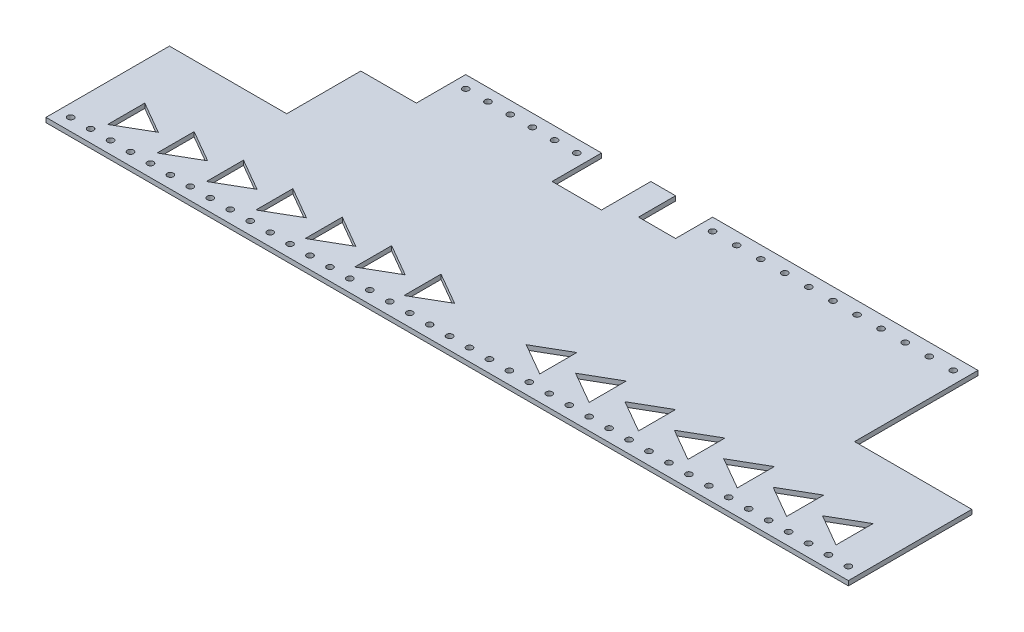
from build123d import *

# Parameters (mm, degrees)
SKETCH1_W          = 825.5
SKETCH1_H          = 254
BASE_FLANGE1_DEPTH = 4.7625
SKETCH6_W          = 38.1
SKETCH6_H          = 76.2
SKETCH6_W_2        = 241.3
SKETCH6_H_2        = 101.6
SKETCH6_W_3        = 50.8
CUT_EXTRUDE1_DEPTH = 432.872948801
SKETCH7_W          = 177.8
SKETCH7_H          = 50.8
SKETCH7_W_2        = 120.65
SKETCH7_H_2        = 25.4
CUT_EXTRUDE2_DEPTH = 432.872948801
CUT_EXTRUDE3_DEPTH = 432.872948801
SKETCH9_R          = 3.175
CUT_EXTRUDE4_DEPTH = 7.62
SKETCH10_R         = 3.175
CUT_EXTRUDE5_DEPTH = 7.62
SKETCH11_R         = 3.175
CUT_EXTRUDE6_DEPTH = 7.62


# Sheet-metal steps are written as plain solids
with BuildPart() as part:
    # Sketch1 → Base-Flange1 (new body)
    with BuildSketch(Plane(origin=(0, 0, 0), x_dir=(1, 0, 0), z_dir=(0, 1, 0))):
        Rectangle(SKETCH1_W, SKETCH1_H)
    extrude(amount=-BASE_FLANGE1_DEPTH)

    # Sketch6 → Cut-Extrude1 (cut, through all)
    with BuildSketch(Plane(origin=(0, 0, 0), x_dir=(1, 0, 0), z_dir=(0, 1, 0))):
        with Locations((0, 127)):
            Rectangle(SKETCH6_W, SKETCH6_H)
        with Locations((-412.75, 50.8)):
            Rectangle(SKETCH6_W_2, SKETCH6_H_2)
        with Locations((412.75, 50.8)):
            Rectangle(SKETCH6_W_2, SKETCH6_H_2)
        with Locations((-69.85, 127)):
            Rectangle(SKETCH6_W_3, SKETCH6_H_2)
    extrude(amount=-CUT_EXTRUDE1_DEPTH, mode=Mode.SUBTRACT)

    # Sketch7 → Cut-Extrude2 (cut, through all)
    with BuildSketch(Plane(origin=(0, 0, 0), x_dir=(1, 0, 0), z_dir=(0, 1, 0))):
        with Locations((-323.85, 101.6)):
            Rectangle(SKETCH7_W, SKETCH7_H)
        with Locations((352.425, 114.3)):
            Rectangle(SKETCH7_W_2, SKETCH7_H_2)
    extrude(amount=-CUT_EXTRUDE2_DEPTH, mode=Mode.SUBTRACT)

    # Sketch8 → Cut-Extrude3 (cut, through all)
    with BuildSketch(Plane(origin=(0, 0, 0), x_dir=(1, 0, 0), z_dir=(0, 1, 0))):
        Polygon((341.654432116, -82.55), (374.65, -101.6), (374.65, -63.5), align=None)
        Polygon((323.85, -101.6), (323.85, -63.5), (290.854432116, -82.55), align=None)
        Polygon((273.05, -101.6), (273.05, -63.5), (240.054432116, -82.55), align=None)
        Polygon((222.25, -101.6), (222.25, -63.5), (189.254432116, -82.55), align=None)
        Polygon((171.45, -101.6), (171.45, -63.5), (138.454432116, -82.55), align=None)
        Polygon((120.65, -101.6), (120.65, -63.5), (87.654432116, -82.55), align=None)
        Polygon((69.85, -101.6), (69.85, -63.5), (36.854432116, -82.55), align=None)
        Polygon((-36.854432116, -82.55), (-69.85, -101.6), (-69.85, -63.5), align=None)
        Polygon((-87.654432116, -82.55), (-120.65, -101.6), (-120.65, -63.5), align=None)
        Polygon((-138.454432116, -82.55), (-171.45, -101.6), (-171.45, -63.5), align=None)
        Polygon((-189.254432116, -82.55), (-222.25, -101.6), (-222.25, -63.5), align=None)
        Polygon((-240.054432116, -82.55), (-273.05, -101.6), (-273.05, -63.5), align=None)
        Polygon((-290.854432116, -82.55), (-323.85, -101.6), (-323.85, -63.5), align=None)
        Polygon((-374.65, -63.5), (-341.654432116, -82.55), (-374.65, -101.6), align=None)
    extrude(amount=-CUT_EXTRUDE3_DEPTH, mode=Mode.SUBTRACT)

    # Sketch9 → Cut-Extrude4 (cut)
    with BuildSketch(Plane(origin=(0, 0, 0), x_dir=(1, 0, 0), z_dir=(0, 1, 0))):
        with Locations(Location((279.4, 114.3, 0), (0, 0, 270))):
            Circle(SKETCH9_R)
        with Locations(Location((254.635, 114.3, 0), (0, 0, 270))):
            Circle(SKETCH9_R)
        with Locations(Location((229.87, 114.3, 0), (0, 0, 270))):
            Circle(SKETCH9_R)
        with Locations(Location((205.105, 114.3, 0), (0, 0, 270))):
            Circle(SKETCH9_R)
        with Locations(Location((180.34, 114.3, 0), (0, 0, 270))):
            Circle(SKETCH9_R)
        with Locations(Location((155.575, 114.3, 0), (0, 0, 270))):
            Circle(SKETCH9_R)
        with Locations(Location((130.81, 114.3, 0), (0, 0, 270))):
            Circle(SKETCH9_R)
        with Locations(Location((106.045, 114.3, 0), (0, 0, 270))):
            Circle(SKETCH9_R)
        with Locations(Location((81.28, 114.3, 0), (0, 0, 270))):
            Circle(SKETCH9_R)
        with Locations(Location((56.515, 114.3, 0), (0, 0, 270))):
            Circle(SKETCH9_R)
        with Locations(Location((31.75, 114.3, 0), (0, 0, 270))):
            Circle(SKETCH9_R)
    extrude(amount=-CUT_EXTRUDE4_DEPTH, mode=Mode.SUBTRACT)

    # Sketch10 → Cut-Extrude5 (cut)
    with BuildSketch(Plane(origin=(0, 0, 0), x_dir=(1, 0, 0), z_dir=(0, 1, 0))):
        with Locations(Location((400.05, -114.3, 0), (0, 0, 270))):
            Circle(SKETCH10_R)
        with Locations(Location((379.534615385, -114.3, 0), (0, 0, 270))):
            Circle(SKETCH10_R)
        with Locations(Location((359.019230769, -114.3, 0), (0, 0, 270))):
            Circle(SKETCH10_R)
        with Locations(Location((338.503846154, -114.3, 0), (0, 0, 270))):
            Circle(SKETCH10_R)
        with Locations(Location((317.988461538, -114.3, 0), (0, 0, 270))):
            Circle(SKETCH10_R)
        with Locations(Location((297.473076923, -114.3, 0), (0, 0, 270))):
            Circle(SKETCH10_R)
        with Locations(Location((276.957692308, -114.3, 0), (0, 0, 270))):
            Circle(SKETCH10_R)
        with Locations(Location((256.442307692, -114.3, 0), (0, 0, 270))):
            Circle(SKETCH10_R)
        with Locations(Location((235.926923077, -114.3, 0), (0, 0, 270))):
            Circle(SKETCH10_R)
        with Locations(Location((215.411538462, -114.3, 0), (0, 0, 270))):
            Circle(SKETCH10_R)
        with Locations(Location((194.896153846, -114.3, 0), (0, 0, 270))):
            Circle(SKETCH10_R)
        with Locations(Location((174.380769231, -114.3, 0), (0, 0, 270))):
            Circle(SKETCH10_R)
        with Locations(Location((153.865384615, -114.3, 0), (0, 0, 270))):
            Circle(SKETCH10_R)
        with Locations(Location((133.35, -114.3, 0), (0, 0, 270))):
            Circle(SKETCH10_R)
        with Locations(Location((112.834615385, -114.3, 0), (0, 0, 270))):
            Circle(SKETCH10_R)
        with Locations(Location((92.319230769, -114.3, 0), (0, 0, 270))):
            Circle(SKETCH10_R)
        with Locations(Location((71.803846154, -114.3, 0), (0, 0, 270))):
            Circle(SKETCH10_R)
        with Locations(Location((51.288461538, -114.3, 0), (0, 0, 270))):
            Circle(SKETCH10_R)
        with Locations(Location((30.773076923, -114.3, 0), (0, 0, 270))):
            Circle(SKETCH10_R)
        with Locations(Location((10.257692308, -114.3, 0), (0, 0, 270))):
            Circle(SKETCH10_R)
        with Locations(Location((-10.257692308, -114.3, 0), (0, 0, 270))):
            Circle(SKETCH10_R)
        with Locations(Location((-30.773076923, -114.3, 0), (0, 0, 270))):
            Circle(SKETCH10_R)
        with Locations(Location((-51.288461538, -114.3, 0), (0, 0, 270))):
            Circle(SKETCH10_R)
        with Locations(Location((-71.803846154, -114.3, 0), (0, 0, 270))):
            Circle(SKETCH10_R)
        with Locations(Location((-92.319230769, -114.3, 0), (0, 0, 270))):
            Circle(SKETCH10_R)
        with Locations(Location((-112.834615385, -114.3, 0), (0, 0, 270))):
            Circle(SKETCH10_R)
        with Locations(Location((-133.35, -114.3, 0), (0, 0, 270))):
            Circle(SKETCH10_R)
        with Locations(Location((-153.865384615, -114.3, 0), (0, 0, 270))):
            Circle(SKETCH10_R)
        with Locations(Location((-174.380769231, -114.3, 0), (0, 0, 270))):
            Circle(SKETCH10_R)
        with Locations(Location((-194.896153846, -114.3, 0), (0, 0, 270))):
            Circle(SKETCH10_R)
        with Locations(Location((-215.411538462, -114.3, 0), (0, 0, 270))):
            Circle(SKETCH10_R)
        with Locations(Location((-235.926923077, -114.3, 0), (0, 0, 270))):
            Circle(SKETCH10_R)
        with Locations(Location((-256.442307692, -114.3, 0), (0, 0, 270))):
            Circle(SKETCH10_R)
        with Locations(Location((-276.957692308, -114.3, 0), (0, 0, 270))):
            Circle(SKETCH10_R)
        with Locations(Location((-297.473076923, -114.3, 0), (0, 0, 270))):
            Circle(SKETCH10_R)
        with Locations(Location((-317.988461538, -114.3, 0), (0, 0, 270))):
            Circle(SKETCH10_R)
        with Locations(Location((-338.503846154, -114.3, 0), (0, 0, 270))):
            Circle(SKETCH10_R)
        with Locations(Location((-359.019230769, -114.3, 0), (0, 0, 270))):
            Circle(SKETCH10_R)
        with Locations(Location((-379.534615385, -114.3, 0), (0, 0, 270))):
            Circle(SKETCH10_R)
        with Locations(Location((-400.05, -114.3, 0), (0, 0, 270))):
            Circle(SKETCH10_R)
    extrude(amount=-CUT_EXTRUDE5_DEPTH, mode=Mode.SUBTRACT)

    # Sketch11 → Cut-Extrude6 (cut)
    with BuildSketch(Plane(origin=(0, 0, 0), x_dir=(1, 0, 0), z_dir=(0, 1, 0))):
        with Locations(Location((-107.95, 114.3, 0), (0, 0, 270))):
            Circle(SKETCH11_R)
        with Locations(Location((-130.81, 114.3, 0), (0, 0, 270))):
            Circle(SKETCH11_R)
        with Locations(Location((-153.67, 114.3, 0), (0, 0, 270))):
            Circle(SKETCH11_R)
        with Locations(Location((-176.53, 114.3, 0), (0, 0, 270))):
            Circle(SKETCH11_R)
        with Locations(Location((-199.39, 114.3, 0), (0, 0, 270))):
            Circle(SKETCH11_R)
        with Locations(Location((-222.25, 114.3, 0), (0, 0, 270))):
            Circle(SKETCH11_R)
    extrude(amount=-CUT_EXTRUDE6_DEPTH, mode=Mode.SUBTRACT)


solid = part.part
